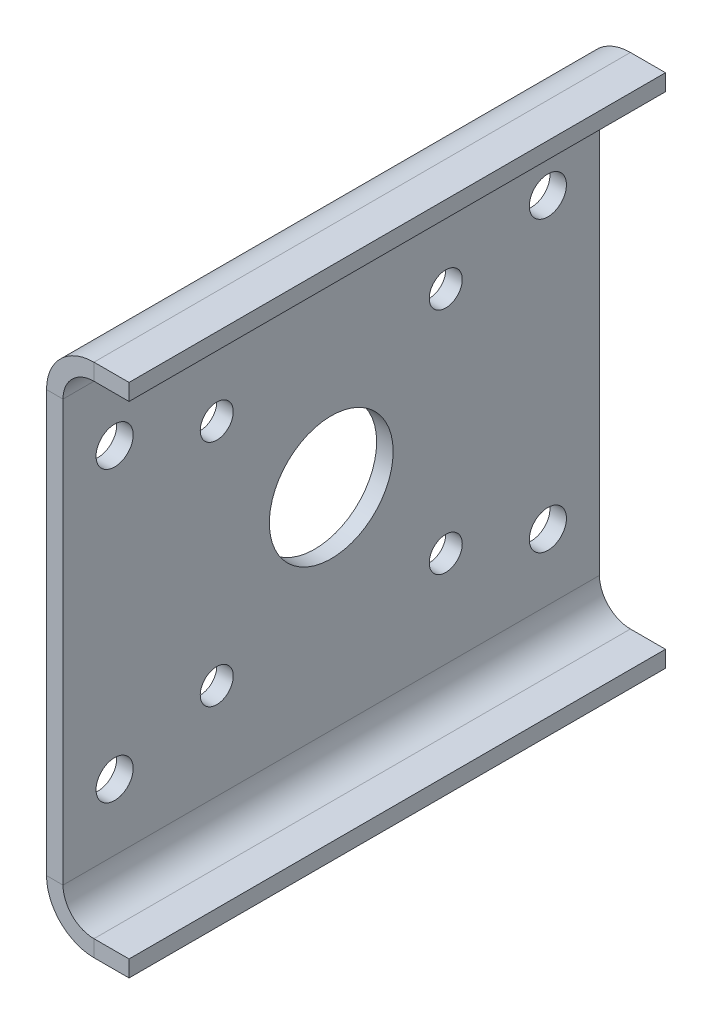
from build123d import *

# Parameters (mm, degrees)
SKETCH1_W                      = 260
SKETCH1_H                      = 250
BASE_FLANGE1_DEPTH             = 8
SKETCH2_R                      = 30
CUT_EXTRUDE1_DEPTH             = 10
EDGE_FLANGE1_STRIP_W           = 62
EDGE_FLANGE1_STRIP_H           = 8
EDGE_FLANGE1_STRIP_CUT_DEPTH   = 260
EDGE_FLANGE1_STRIP_2_W         = 62
EDGE_FLANGE1_STRIP_2_H         = 8
EDGE_FLANGE1_STRIP_CUT_2_DEPTH = 260
EDGE_FLANGE1_DEPTH             = 260
EDGE_FLANGE1_BEND_DEPTH        = 260
SKETCH9_R                      = 9
CUT_EXTRUDE2_DEPTH             = 10
SKETCH10_R                     = 8
CUT_EXTRUDE3_DEPTH             = 10
CIRPATTERN1_COUNT              = 4


# Sheet-metal steps are written as plain solids
with BuildPart() as part:
    # Sketch1 → Base-Flange1 (new body)
    with BuildSketch(Plane(origin=(0, 0, 0), x_dir=(0, 0, -1), z_dir=(1, 0, 0))):
        Rectangle(SKETCH1_W, SKETCH1_H)
    extrude(amount=-BASE_FLANGE1_DEPTH)

    # Sketch2 → Cut-Extrude1 (cut)
    with BuildSketch(Plane(origin=(0, 0, 0), x_dir=(0, 0, -1), z_dir=(1, 0, 0))):
        Circle(SKETCH2_R)
    extrude(amount=-CUT_EXTRUDE1_DEPTH, mode=Mode.SUBTRACT)

    # Edge-Flange1 strip (across the edge) → Edge-Flange1 strip cut (cut)
    with BuildSketch(Plane(origin=(0, 125, -130), x_dir=(0, -1, 0), z_dir=(0, 0, 1))):
        with Locations((-8, -4)):
            Rectangle(EDGE_FLANGE1_STRIP_W, EDGE_FLANGE1_STRIP_H)
    extrude(amount=EDGE_FLANGE1_STRIP_CUT_DEPTH, mode=Mode.SUBTRACT)

    # Edge-Flange1 strip 2 (across the edge) → Edge-Flange1 strip cut 2 (cut)
    with BuildSketch(Plane(origin=(0, -125, 130), x_dir=(0, 1, 0), z_dir=(0, 0, -1))):
        with Locations((-8, -4)):
            Rectangle(EDGE_FLANGE1_STRIP_2_W, EDGE_FLANGE1_STRIP_2_H)
    extrude(amount=EDGE_FLANGE1_STRIP_CUT_2_DEPTH, mode=Mode.SUBTRACT)

    # Edge-Flange1 section (across the edge) → Edge-Flange1 (add)
    with BuildSketch(Plane(origin=(0, 125, -130), x_dir=(0, -1, 0), z_dir=(0, 0, 1))):
        with BuildLine():
            Line((0, 15), (0, 32))
            Line((0, 32), (8, 32))
            Line((8, 32), (8, 15))
            ThreePointArc((8, 15), (12.393398282, 4.393398282), (23, 0))
            Line((23, 0), (23, -8))
            ThreePointArc((23, -8), (6.736544033, -1.263455967), (0, 15))
        make_face()
    extrude(amount=EDGE_FLANGE1_DEPTH)

    # Edge-Flange1 section 2 (across the edge) → Edge-Flange1 bend (add)
    with BuildSketch(Plane(origin=(0, -125, 130), x_dir=(0, 1, 0), z_dir=(0, 0, -1))):
        with BuildLine():
            Line((0, 15), (0, 32))
            Line((0, 32), (8, 32))
            Line((8, 32), (8, 15))
            ThreePointArc((8, 15), (12.393398282, 4.393398282), (23, 0))
            Line((23, 0), (23, -8))
            ThreePointArc((23, -8), (6.736544033, -1.263455967), (0, 15))
        make_face()
    extrude(amount=EDGE_FLANGE1_BEND_DEPTH)

    # Sketch9 → Cut-Extrude2 (cut)
    with BuildSketch(Plane(origin=(0, 0, 0), x_dir=(0, 0, -1), z_dir=(1, 0, 0))):
        with Locations((-105, -70)):
            Circle(SKETCH9_R)
        with Locations((-105, 70)):
            Circle(SKETCH9_R)
    cut_extrude2 = extrude(amount=-CUT_EXTRUDE2_DEPTH, mode=Mode.SUBTRACT)

    # Mirror1: Cut-Extrude2 across plane
    add(cut_extrude2.mirror(Plane.XY), mode=Mode.SUBTRACT)

    # Sketch10 → Cut-Extrude3 (cut)
    with BuildSketch(Plane.ZY.offset(8)):
        with Locations((55.5, 55.5)):
            Circle(SKETCH10_R)
    cut_extrude3 = extrude(amount=-CUT_EXTRUDE3_DEPTH, mode=Mode.SUBTRACT)

    # CirPattern1: Cut-Extrude3 ×4 about axis
    cirpattern1_axis = Axis((0, 0, 0), (1, 0, 0))
    for i in range(1, CIRPATTERN1_COUNT):
        add(cut_extrude3.rotate(cirpattern1_axis, i * 360 / CIRPATTERN1_COUNT), mode=Mode.SUBTRACT)


solid = part.part
